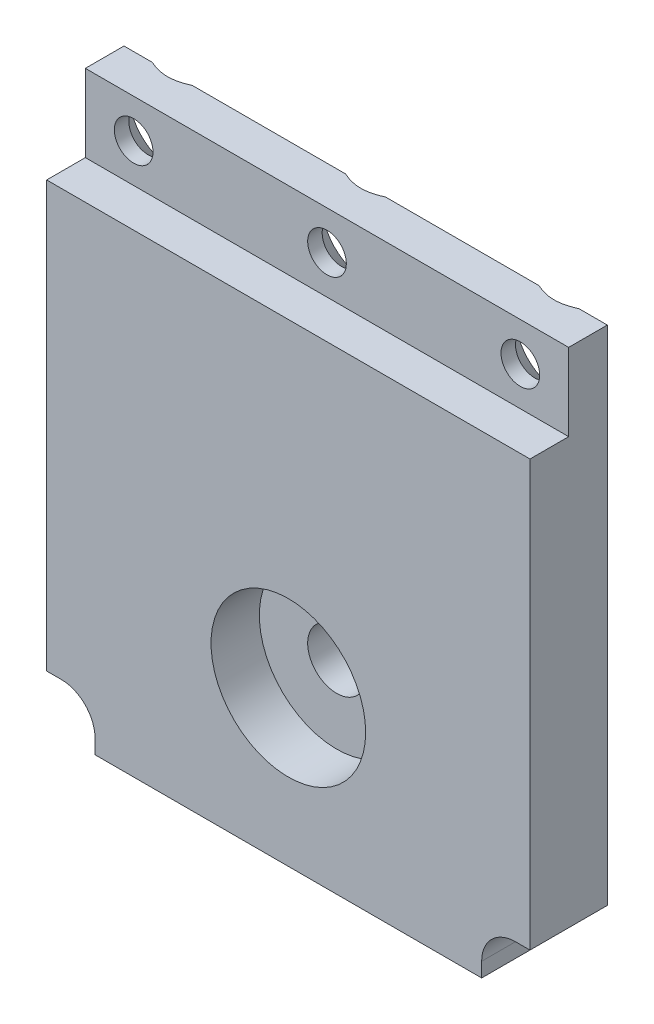
from build123d import *

# Parameters (mm, degrees)
BOSS_EXTRU_1_DEPTH      = 8
ESQUISSE2_R             = 2
ENL_V_MAT_EXTRU_1_DEPTH = 10
ESQUISSE3_R             = 2
ENL_V_MAT_EXTRU_2_DEPTH = 39.745967532
CHANFREIN1_SIZE         = 2.5
ESQUISSE4_R             = 8
ENL_V_MAT_EXTRU_3_DEPTH = 5
ESQUISSE5_R             = 3
ENL_V_MAT_EXTRU_4_DEPTH = 39.23937761
ESQUISSE6_W             = 50
ESQUISSE6_H             = 8
ENL_V_MAT_EXTRU_5_DEPTH = 4
CONG_1_R                = 3.5


with BuildPart() as part:
    # Esquisse1 → Boss.-Extru.1 (new body)
    with BuildSketch(Plane.XY):
        Polygon((-25, -23.5), (-20, -23.5), (-20, -28.5), (20, -28.5), (20, -23.5), (25, -23.5), (25, 28.5), (-25, 28.5), align=None)
    extrude(amount=BOSS_EXTRU_1_DEPTH)

    # Esquisse2 → Enlèv. mat.-Extru.1 (cut)
    with BuildSketch(Plane.XZ.offset(28.5)):
        with Locations(Location((-15, 4, 0), (0, 0, 270))):
            Circle(ESQUISSE2_R)
        with Locations(Location((15, 4, 0), (0, 0, 270))):
            Circle(ESQUISSE2_R)
    extrude(amount=-ENL_V_MAT_EXTRU_1_DEPTH, mode=Mode.SUBTRACT)

    # Esquisse3 → Enlèv. mat.-Extru.2 (cut, through all)
    with BuildSketch(Plane.XY.offset(8)):
        with Locations((-20, 24.5)):
            Circle(ESQUISSE3_R)
        with Locations((20, 24.5)):
            Circle(ESQUISSE3_R)
        with Locations((0, 24.5)):
            Circle(ESQUISSE3_R)
    extrude(amount=-ENL_V_MAT_EXTRU_2_DEPTH, mode=Mode.SUBTRACT)

    # Chanfrein1
    # the kernel refuses this chamfer: 2.5 mm, written as the material it takes off along each edge
    with BuildSketch(Plane(origin=(-20, 24.5, 0), x_dir=(1, 0, 0), z_dir=(0, -1, 0))) as chanfrein1_piece_1:
        Polygon((2 + CHANFREIN1_SIZE, 0), (2, CHANFREIN1_SIZE), (2, 0), align=None)
    revolve(axis=Axis((-20, 24.5, 0), (0, 0, 1)), mode=Mode.SUBTRACT)
    with BuildSketch(Plane(origin=(20, 24.5, 0), x_dir=(1, 0, 0), z_dir=(0, -1, 0))) as chanfrein1_piece_2:
        Polygon((2 + CHANFREIN1_SIZE, 0), (2, CHANFREIN1_SIZE), (2, 0), align=None)
    revolve(axis=Axis((20, 24.5, 0), (0, 0, 1)), mode=Mode.SUBTRACT)
    with BuildSketch(Plane(origin=(0, 24.5, 0), x_dir=(1, 0, 0), z_dir=(0, -1, 0))) as chanfrein1_piece_3:
        Polygon((2 + CHANFREIN1_SIZE, 0), (2, CHANFREIN1_SIZE), (2, 0), align=None)
    revolve(axis=Axis((0, 24.5, 0), (0, 0, 1)), mode=Mode.SUBTRACT)

    # Esquisse4 → Enlèv. mat.-Extru.3 (cut)
    with BuildSketch(Plane.XY.offset(8)):
        with Locations((0, -12.5)):
            Circle(ESQUISSE4_R)
    extrude(amount=-ENL_V_MAT_EXTRU_3_DEPTH, mode=Mode.SUBTRACT)

    # Esquisse5 → Enlèv. mat.-Extru.4 (cut, through all)
    with BuildSketch(Plane.XY.offset(3)):
        with Locations((0, -12.5)):
            Circle(ESQUISSE5_R)
    extrude(amount=-ENL_V_MAT_EXTRU_4_DEPTH, mode=Mode.SUBTRACT)

    # Esquisse6 → Enlèv. mat.-Extru.5 (cut)
    with BuildSketch(Plane.XY.offset(8)):
        with Locations((0, 24.5)):
            Rectangle(ESQUISSE6_W, ESQUISSE6_H)
    extrude(amount=-ENL_V_MAT_EXTRU_5_DEPTH, mode=Mode.SUBTRACT)

    # Congé1
    cong_1_edges = [part.edges().sort_by_distance(p)[0] for p in [
        (20, -23.5, 4),
        (-20, -23.5, 4),
    ]]
    fillet(cong_1_edges, radius=CONG_1_R)


solid = part.part
